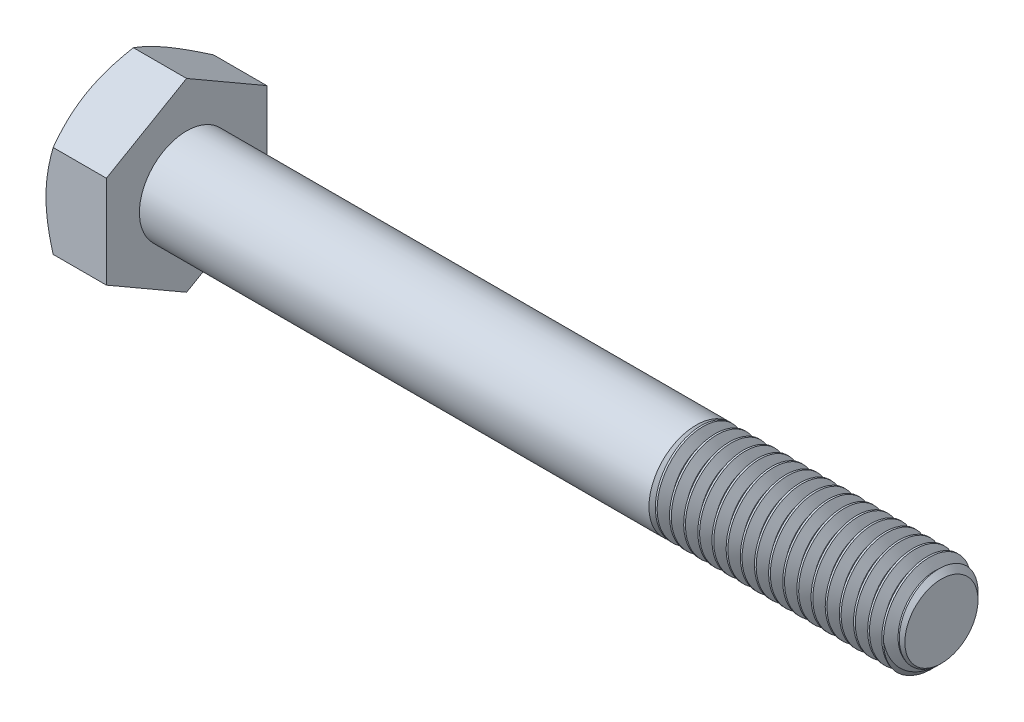
from build123d import *

# Parameters (mm, degrees)
SKETCH2_R           = 5
BOSS_EXTRUDE1_DEPTH = 80
CHAMFER1_SIZE       = 1.125
CUT_SWEEP1_PITCH    = 1.5
BOSS_EXTRUDE2_DEPTH = 6.4
SKETCH6_OUTSIDE_W   = 343.166
SKETCH6_OUTSIDE_H   = 345.796
SKETCH6_OUTSIDE_R   = 8.5
CUT_EXTRUDE1_DEPTH  = 88.370151392
CUT_EXTRUDE1_DRAFT  = -60
SKETCH7_W           = 0.395125951
SKETCH7_H           = 0.395125952
CUT_EXTRUDE2_DEPTH  = 0.25


with BuildPart() as part:
    # Sketch2 → Boss-Extrude1 (new body)
    with BuildSketch(Plane(origin=(43.2, 0, 0), x_dir=(0, 0, -1), z_dir=(1, 0, 0))):
        Circle(SKETCH2_R)
    extrude(amount=-BOSS_EXTRUDE1_DEPTH)

    # Chamfer1
    chamfer1_edges = [part.edges().sort_by_distance(p)[0] for p in [
        (43.2, 0, 5),
    ]]
    chamfer(chamfer1_edges, length=CHAMFER1_SIZE)

    # Cut-Sweep1: the profile of Sketch5 profile screwed along a right-hand helix of 54.333333 turns, 6 arcs to a turn; built about Z, then put on its axis
    cut_sweep1_z = Axis((0, 0, 0), (0, 0, 1))
    cut_sweep1_corners = [(5.0003, 0, 0.000173205), (4.025721421, 0, -0.5625), (4.025721421, 0, -0.75), (5.0003, 0, -1.312673205)]
    with BuildLine(mode=Mode.PRIVATE) as cut_sweep1_profile:
        Line(cut_sweep1_corners[0], cut_sweep1_corners[1])
        Line(cut_sweep1_corners[1], cut_sweep1_corners[2])
        Line(cut_sweep1_corners[2], cut_sweep1_corners[3])
        Line(cut_sweep1_corners[3], cut_sweep1_corners[0])
    cut_sweep1_cap = Face(cut_sweep1_profile.wire())
    cut_sweep1_turn_angles = [0, 30, 60, 90, 120, 150, 180, 210, 240, 270, 300, 330, 360, 390, 420, 450, 480, 510, 540, 570, 600, 630, 660, 690, 720]
    cut_sweep1_turn_weights = [1, 0.8660254037844387, 1, 0.8660254037844387, 1, 0.8660254037844387, 1, 0.8660254037844387, 1, 0.8660254037844387, 1, 0.8660254037844387, 1, 0.8660254037844387, 1, 0.8660254037844387, 1, 0.8660254037844387, 1, 0.8660254037844387, 1, 0.8660254037844387, 1, 0.8660254037844387, 1]
    cut_sweep1_turn_rails = [Edge.make_bspline([Vector(p[0], p[1], 0).rotate(cut_sweep1_z, cut_sweep1_turn_angles[k]) / cut_sweep1_turn_weights[k] + Vector(0, 0, p[2] + CUT_SWEEP1_PITCH * cut_sweep1_turn_angles[k] / 360) for k in range(25)], [0, 0, 0, 1, 1, 2, 2, 3, 3, 4, 4, 5, 5, 6, 6, 7, 7, 8, 8, 9, 9, 10, 10, 11, 11, 12, 12, 12], 2, cut_sweep1_turn_weights) for p in cut_sweep1_corners]
    cut_sweep1_turn_sides = [Face.make_surface_from_curves(cut_sweep1_turn_rails[p[0]], cut_sweep1_turn_rails[p[1]]) for p in [(0, 1), (1, 2), (2, 3), (3, 0)]]
    cut_sweep1_last_angles = [19440, 19470, 19500, 19530, 19560]
    cut_sweep1_last_weights = [1, 0.8660254037844387, 1, 0.8660254037846767, 1]
    cut_sweep1_last_rails = [Edge.make_bspline([Vector(p[0], p[1], 0).rotate(cut_sweep1_z, cut_sweep1_last_angles[k]) / cut_sweep1_last_weights[k] + Vector(0, 0, p[2] + CUT_SWEEP1_PITCH * cut_sweep1_last_angles[k] / 360) for k in range(5)], [0, 0, 0, 1, 1, 2, 2, 2], 2, cut_sweep1_last_weights) for p in cut_sweep1_corners]
    cut_sweep1_last_sides = [Face.make_surface_from_curves(cut_sweep1_last_rails[p[0]], cut_sweep1_last_rails[p[1]]) for p in [(0, 1), (1, 2), (2, 3), (3, 0)]]
    cut_sweep1 = Plane(origin=(43.2, 0, 0), x_dir=(0, 1, 0), z_dir=(-1, 0, 0)) * Solid(Shell([*[p.moved(Location((0, 0, 2 * CUT_SWEEP1_PITCH * i))) for i in range(27) for p in cut_sweep1_turn_sides], *cut_sweep1_last_sides, cut_sweep1_cap, cut_sweep1_cap.rotate(cut_sweep1_z, 19560).moved(Location((0, 0, CUT_SWEEP1_PITCH * 19560 / 360)))]))
    add(cut_sweep1, mode=Mode.SUBTRACT)

    # Sketch3 → Boss-Extrude2 (add)
    with BuildSketch(Plane.ZY.offset(36.8)):
        Polygon((-8.5, -4.907477288), (0, -9.814954576), (8.5, -4.907477288), (8.5, 4.907477288), (0, 9.814954576), (-8.5, 4.907477288), align=None)
    extrude(amount=BOSS_EXTRUDE2_DEPTH)


with BuildPart() as cut_extrude1_tool:
    # Sketch6 outside → Cut-Extrude1 (with draft: the straight prism first)
    with BuildSketch(Plane.ZY.offset(43.2)):
        Rectangle(SKETCH6_OUTSIDE_W, SKETCH6_OUTSIDE_H)
        Circle(SKETCH6_OUTSIDE_R, mode=Mode.SUBTRACT)
    extrude(amount=-CUT_EXTRUDE1_DEPTH)
    # Cut-Extrude1: the draft: its side faces are tilted about the plane it starts from
    cut_extrude1_sides = [cut_extrude1_tool.faces().sort_by_distance(p)[0] for p in [
        (0.985075696, -172.898, 0),
        (0.985075696, 0, 171.583),
        (0.985075696, 172.898, 0),
        (0.985075696, 0, -171.583),
        (0.985075696, 0, -8.5),
    ]]
    draft(cut_extrude1_sides, Plane.ZY.offset(43.2), CUT_EXTRUDE1_DRAFT)


with BuildPart() as part_1:
    add(part.part)

    # Cut-Extrude1: cut by cut_extrude1_tool
    add(cut_extrude1_tool.part, mode=Mode.SUBTRACT)

    # Sketch7 → Cut-Extrude2 (cut)
    # profile 1 of 4: a face of its own
    with BuildSketch(Plane.ZY.offset(43.2)):
        with BuildLine():
            Line((-2.568318685, 4.25), (-2.963444636, 4.25))
            Line((-2.963444636, 4.25), (-2.963444636, 6.651624924))
            add(Edge.make_bspline(
                [(-2.963444636, 6.651624924), (-2.986196024, 6.62968401), (-3.033482289, 6.584082225), (-3.113414724, 6.519544312), (-3.202629538, 6.454132402), (-3.299968218, 6.391231537), (-3.399188536, 6.332017157), (-3.495072199, 6.278762925), (-3.586018389, 6.233696924), (-3.645925135, 6.209054656), (-3.674671349, 6.19723008)],
                knots=[0, 0, 0, 0, 0.893362401, 1.856755847, 2.901947673, 4.020460078, 5.132200827, 6.168787962, 7.121294059, 8, 8, 8, 8], degree=3))
            Line((-3.674671349, 6.19723008), (-3.674671349, 6.561486816))
            add(Edge.make_bspline(
                [(-3.674671349, 6.561486816), (-3.625296755, 6.586914831), (-3.527982354, 6.637031942), (-3.390498149, 6.723591083), (-3.262141854, 6.817424755), (-3.145038274, 6.918512183), (-3.040062377, 7.021841681), (-2.951597664, 7.126105204), (-2.877576021, 7.2274809), (-2.840437961, 7.298179205), (-2.822681016, 7.331982422)],
                knots=[0, 0, 0, 0, 1.141258006, 2.249351951, 3.335817539, 4.406819942, 5.426913362, 6.360259544, 7.215985427, 8, 8, 8, 8], degree=3))
            Line((-2.822681016, 7.331982422), (-2.568318685, 7.331982422))
            Line((-2.568318685, 7.331982422), (-2.568318685, 4.25))
        make_face()
    # profile 2 of 4: a face of its own
    with BuildSketch(Plane.ZY.offset(43.2)):
        with BuildLine():
            add(Edge.make_bspline(
                [(-1.580503806, 5.770000145), (-1.580105717, 5.814044503), (-1.579326027, 5.900308852), (-1.574489865, 6.026529092), (-1.566046319, 6.146395227), (-1.553442429, 6.25980316), (-1.538517061, 6.367008875), (-1.519113989, 6.467859377), (-1.497282713, 6.562580942), (-1.471089099, 6.651074836), (-1.442310892, 6.734101948), (-1.409661098, 6.811529082), (-1.372925651, 6.883274147), (-1.333909869, 6.950081181), (-1.290559882, 7.010911058), (-1.245492208, 7.067470914), (-1.195431598, 7.117686479), (-1.142459679, 7.162849803), (-1.085796427, 7.202703805), (-1.025741645, 7.237093001), (-0.962526408, 7.267456182), (-0.894945905, 7.290313577), (-0.824403092, 7.308947199), (-0.750354969, 7.322654317), (-0.672719934, 7.330735126), (-0.619667301, 7.33156196), (-0.592688927, 7.331982422)],
                knots=[0, 0, 0, 0, 1.514747001, 2.966751498, 4.343369068, 5.64627492, 6.890416844, 8.064737671, 9.177176366, 10.232018008, 11.237056675, 12.19799043, 13.119080079, 14.007588942, 14.855863561, 15.685992447, 16.491747269, 17.290132607, 18.077525251, 18.870243746, 19.668095604, 20.485086593, 21.319398728, 22.175900658, 23.072407314, 24, 24, 24, 24], degree=3))
            add(Edge.make_bspline(
                [(-0.592688927, 7.331982422), (-0.553108144, 7.330818775), (-0.475350106, 7.328532744), (-0.361822971, 7.309888287), (-0.254830962, 7.277994072), (-0.154443593, 7.234967399), (-0.06237697, 7.180315243), (0.019842406, 7.113877221), (0.091327664, 7.036350919), (0.151298654, 6.946817676), (0.203719286, 6.847747416), (0.250288624, 6.738695476), (0.292385953, 6.61978406), (0.322259135, 6.513341743), (0.34356765, 6.421456958), (0.357672195, 6.345672987), (0.369381794, 6.263901655), (0.37835293, 6.17634079), (0.385713535, 6.083088599), (0.391397793, 5.98408702), (0.394283136, 5.879088618), (0.394839746, 5.807044656), (0.395125952, 5.770000145)],
                knots=[0, 0, 0, 0, 1.134486744, 2.228744715, 3.287356444, 4.328707449, 5.352829806, 6.347195599, 7.349461267, 8.364207941, 9.428085653, 10.559314403, 11.761222316, 13.04268526, 13.726896727, 14.465273606, 15.252205015, 16.094778733, 16.988606776, 17.934225168, 18.937792761, 20, 20, 20, 20], degree=3))
            add(Edge.make_bspline(
                [(0.395125952, 5.770000145), (0.394720405, 5.72616267), (0.393928091, 5.640517533), (0.389221516, 5.515309367), (0.380269187, 5.396347563), (0.369253182, 5.283359615), (0.352588275, 5.176647146), (0.334630934, 5.075756765), (0.312422139, 4.981146602), (0.286509689, 4.892775193), (0.257326387, 4.81017526), (0.22532238, 4.73272256), (0.189874869, 4.660470016), (0.149928803, 4.594122345), (0.107311894, 4.532798891), (0.061712021, 4.476269617), (0.01216241, 4.425348143), (-0.041286868, 4.380320284), (-0.097552273, 4.339759529), (-0.157753059, 4.305030807), (-0.221625737, 4.276258665), (-0.288743547, 4.251659912), (-0.359787497, 4.233635389), (-0.434197342, 4.219837898), (-0.512247246, 4.211712937), (-0.565505082, 4.210901552), (-0.592688927, 4.210487405)],
                knots=[0, 0, 0, 0, 1.508974709, 2.94807912, 4.311757619, 5.615040294, 6.854280449, 8.028314546, 9.141715822, 10.197470207, 11.196696834, 12.155719058, 13.080757287, 13.963948316, 14.818758719, 15.649605906, 16.461113142, 17.260189315, 18.052359509, 18.845763934, 19.647754795, 20.461145776, 21.303032214, 22.167241874, 23.064524267, 24, 24, 24, 24], degree=3))
            add(Edge.make_bspline(
                [(-0.592688927, 4.210487405), (-0.6283301, 4.211504071), (-0.697820578, 4.213486291), (-0.799306296, 4.226954252), (-0.894556056, 4.250658495), (-0.984373234, 4.282449228), (-1.067748262, 4.324971164), (-1.145079221, 4.376707402), (-1.217920022, 4.436454245), (-1.259851615, 4.483593132), (-1.281072421, 4.507449253)],
                knots=[0, 0, 0, 0, 1.10322584, 2.150986741, 3.161425019, 4.136713905, 5.093944212, 6.049774532, 7.013026876, 8, 8, 8, 8], degree=3))
            add(Edge.make_bspline(
                [(-1.281072421, 4.507449253), (-1.305498056, 4.54268359), (-1.355864762, 4.615338302), (-1.414814624, 4.739221326), (-1.467398945, 4.875599141), (-1.508667995, 5.027147464), (-1.540991949, 5.192660143), (-1.564337915, 5.372461948), (-1.577549433, 5.566475199), (-1.579496784, 5.700627011), (-1.580503806, 5.770000145)],
                knots=[0, 0, 0, 0, 0.779365345, 1.607084704, 2.489375761, 3.438383567, 4.461919411, 5.557722155, 6.737039282, 8, 8, 8, 8], degree=3))
        make_face()
        with BuildLine():
            add(Edge.make_bspline(
                [(-1.185377855, 5.771234913), (-1.184985526, 5.711957182), (-1.184234522, 5.598486491), (-1.176388355, 5.436374033), (-1.162881502, 5.290126467), (-1.145024559, 5.159946283), (-1.121446166, 5.045657386), (-1.091840703, 4.94755102), (-1.058468306, 4.864449686), (-1.017170596, 4.79738336), (-0.971954166, 4.742714521), (-0.925271291, 4.695697552), (-0.876023686, 4.655734205), (-0.824532686, 4.622412923), (-0.769999369, 4.597184238), (-0.71302005, 4.57889843), (-0.653582329, 4.568375229), (-0.61310254, 4.566863243), (-0.592688927, 4.566100761)],
                knots=[0, 0, 0, 0, 1.89448813, 3.626469325, 5.185477471, 6.587276848, 7.82441448, 8.910550357, 9.859733512, 10.6775885, 11.416198291, 12.123144072, 12.791880183, 13.439617036, 14.078171869, 14.70637855, 15.347637704, 16, 16, 16, 16], degree=3))
            add(Edge.make_bspline(
                [(-0.592688927, 4.566100761), (-0.572280426, 4.566879903), (-0.531810774, 4.568424926), (-0.472235717, 4.578716081), (-0.415478091, 4.597943229), (-0.361026084, 4.623082807), (-0.309160831, 4.655644596), (-0.260155096, 4.695758894), (-0.213226305, 4.742747946), (-0.168212986, 4.798052211), (-0.127229907, 4.865428606), (-0.093231484, 4.948462246), (-0.064087407, 5.046740426), (-0.040379634, 5.160971093), (-0.022449029, 5.290945453), (-0.009023839, 5.436787394), (-0.001125164, 5.598691266), (-0.000386554, 5.711956914), (0, 5.771234913)],
                knots=[0, 0, 0, 0, 0.652509534, 1.29391342, 1.924290653, 2.562989607, 3.207355802, 3.876242846, 4.583348185, 5.32723334, 6.150888545, 7.094226006, 8.186903555, 9.424320409, 10.81992305, 12.379283064, 14.105084285, 16, 16, 16, 16], degree=3))
            add(Edge.make_bspline(
                [(0, 5.771234913), (-0.000374177, 5.829279529), (-0.001091087, 5.940490817), (-0.00919348, 6.099480175), (-0.021890658, 6.243273035), (-0.03925838, 6.372001961), (-0.06234008, 6.4855272), (-0.090335034, 6.584090432), (-0.123695207, 6.667481456), (-0.163360333, 6.736537934), (-0.207515555, 6.79318298), (-0.253639871, 6.842214197), (-0.302886392, 6.883913649), (-0.356127619, 6.917365565), (-0.411647487, 6.944353326), (-0.470721702, 6.962926991), (-0.53276961, 6.974338069), (-0.575352285, 6.975684332), (-0.597010617, 6.976369066)],
                knots=[0, 0, 0, 0, 1.850066095, 3.544656626, 5.0727657, 6.45041401, 7.682899467, 8.762389858, 9.712573485, 10.538438529, 11.291566246, 11.996865408, 12.681389046, 13.341983376, 13.996294293, 14.643563182, 15.31009126, 16, 16, 16, 16], degree=3))
            add(Edge.make_bspline(
                [(-0.597010617, 6.976369066), (-0.617422948, 6.975833322), (-0.65767345, 6.974776906), (-0.716605455, 6.964693418), (-0.772454624, 6.94783158), (-0.825860807, 6.924990582), (-0.875490749, 6.894251111), (-0.923312648, 6.858360591), (-0.967086713, 6.814631997), (-0.99346458, 6.781941185), (-1.006953792, 6.765223635)],
                knots=[0, 0, 0, 0, 1.021318143, 2.013908504, 2.982026795, 3.937174072, 4.91255697, 5.897578595, 6.924855925, 8, 8, 8, 8], degree=3))
            add(Edge.make_bspline(
                [(-1.006953792, 6.765223635), (-1.021639429, 6.740670733), (-1.052652401, 6.688820173), (-1.087354113, 6.598701764), (-1.118008235, 6.495713576), (-1.14324674, 6.378271061), (-1.161505027, 6.24657568), (-1.175919239, 6.100780372), (-1.183406886, 5.94068159), (-1.184702739, 5.829275502), (-1.185377855, 5.771234913)],
                knots=[0, 0, 0, 0, 0.671104906, 1.417232262, 2.260109084, 3.195198885, 4.23592645, 5.382417421, 6.636286093, 8, 8, 8, 8], degree=3))
        make_face(mode=Mode.SUBTRACT)
    # profile 3 of 4: a face of its own
    with BuildSketch(Plane.ZY.offset(43.2)):
        with Locations((1.185377854, 4.447562976)):
            Rectangle(SKETCH7_W, SKETCH7_H)
    # profile 4 of 4: a face of its own
    with BuildSketch(Plane.ZY.offset(43.2)):
        with BuildLine():
            Line((2.015142353, 5.000739308), (2.410268304, 5.040251903))
            add(Edge.make_bspline(
                [(2.410268304, 5.040251903), (2.413840479, 5.020007204), (2.420745795, 4.980872485), (2.436328917, 4.925098804), (2.452134025, 4.873095247), (2.47253629, 4.826020329), (2.493783762, 4.782595367), (2.517845941, 4.74325551), (2.545151535, 4.708790889), (2.583710618, 4.668404495), (2.638420343, 4.626260608), (2.714255437, 4.592122416), (2.797681164, 4.569168901), (2.856473329, 4.567146852), (2.886888983, 4.566100761)],
                knots=[0, 0, 0, 0, 0.994516507, 1.922484754, 2.80151264, 3.623050913, 4.402748861, 5.140924173, 5.850441436, 6.526872911, 7.841975818, 9.161260782, 10.53140107, 12, 12, 12, 12], degree=3))
            add(Edge.make_bspline(
                [(2.886888983, 4.566100761), (2.913502977, 4.567059155), (2.965883441, 4.568945423), (3.042255893, 4.583567924), (3.114884907, 4.606992865), (3.182506216, 4.640602748), (3.244873712, 4.681505039), (3.299349616, 4.7301052), (3.346661352, 4.784310082), (3.385518984, 4.846764506), (3.418685022, 4.918097941), (3.450022517, 4.9992176), (3.479667267, 5.091521035), (3.506013778, 5.193830946), (3.529605789, 5.302412185), (3.546162435, 5.414804415), (3.556349093, 5.528822559), (3.557438834, 5.605548926), (3.557985717, 5.644053748)],
                knots=[0, 0, 0, 0, 0.897794352, 1.766998465, 2.614902619, 3.466100941, 4.308008728, 5.124841802, 5.922729683, 6.728261092, 7.598214292, 8.574707161, 9.662086263, 10.868425066, 12.139522319, 13.41071447, 14.70057738, 16, 16, 16, 16], degree=3))
            add(Edge.make_bspline(
                [(3.557985717, 5.644053748), (3.557798688, 5.654549729), (3.557351233, 5.67966075), (3.556581539, 5.704764073), (3.556133564, 5.719374632)],
                knots=[0, 0, 0, 0, 0.835966126, 2, 2, 2, 2], degree=3))
            add(Edge.make_bspline(
                [(3.556133564, 5.719374632), (3.537085168, 5.69044826), (3.499019071, 5.632642126), (3.428891918, 5.555059298), (3.348665223, 5.486242275), (3.259556771, 5.426725431), (3.16376686, 5.377881138), (3.062961935, 5.342388897), (2.95801097, 5.320472904), (2.886583026, 5.318060151), (2.85046331, 5.316840069)],
                knots=[0, 0, 0, 0, 0.978840568, 1.956103883, 2.947027447, 3.962820877, 4.980997961, 5.980964245, 6.979013046, 8, 8, 8, 8], degree=3))
            add(Edge.make_bspline(
                [(2.85046331, 5.316840069), (2.820363425, 5.317619924), (2.761111224, 5.319155084), (2.674317174, 5.332799095), (2.59083831, 5.353260274), (2.511465687, 5.38423949), (2.43496438, 5.42255281), (2.362137653, 5.469579471), (2.292873286, 5.525255467), (2.228066286, 5.588887534), (2.168924197, 5.659813801), (2.1167677, 5.736306369), (2.073457016, 5.818739261), (2.037421028, 5.906083595), (2.009615469, 5.999183298), (1.990294246, 6.097820225), (1.977299795, 6.201617852), (1.976193821, 6.272715691), (1.975629758, 6.308976638)],
                knots=[0, 0, 0, 0, 0.975490236, 1.920271282, 2.842894855, 3.757591483, 4.67685385, 5.613562631, 6.563069669, 7.554119451, 8.55387214, 9.553424333, 10.550567425, 11.568071726, 12.613215376, 13.695622473, 14.824733476, 16, 16, 16, 16], degree=3))
            add(Edge.make_bspline(
                [(1.975629758, 6.308976638), (1.976474577, 6.346465906), (1.978127192, 6.419801416), (1.990610702, 6.527027039), (2.011263538, 6.628609974), (2.041382852, 6.724356326), (2.078630372, 6.81488129), (2.12559805, 6.899532199), (2.180477352, 6.978671167), (2.24359618, 7.051535224), (2.312963199, 7.116914452), (2.386610891, 7.175266551), (2.465498944, 7.223231698), (2.548114747, 7.263222666), (2.635083515, 7.294128288), (2.726256605, 7.316466558), (2.82188631, 7.329573957), (2.887054298, 7.331169976), (2.920227735, 7.331982422)],
                knots=[0, 0, 0, 0, 1.151671969, 2.252870106, 3.311924673, 4.331900944, 5.332425074, 6.314476151, 7.300265758, 8.286521684, 9.270545387, 10.225535917, 11.167946231, 12.101233205, 13.04124339, 13.998220545, 14.981004193, 16, 16, 16, 16], degree=3))
            add(Edge.make_bspline(
                [(2.920227735, 7.331982422), (2.94432121, 7.331495139), (2.99221098, 7.330526585), (3.063480901, 7.323131988), (3.133063159, 7.309802016), (3.201411424, 7.292975846), (3.267372851, 7.269619853), (3.332218948, 7.242611039), (3.395167577, 7.209577215), (3.456585533, 7.172013619), (3.516087062, 7.130580547), (3.5708319, 7.08297843), (3.623008165, 7.032461421), (3.671554138, 6.977444063), (3.714934318, 6.917077255), (3.756093766, 6.853495263), (3.793048395, 6.785310706), (3.82674845, 6.712431238), (3.856742807, 6.633356658), (3.881765615, 6.546339503), (3.903215744, 6.451078381), (3.921075091, 6.347447023), (3.934318089, 6.235519309), (3.944064162, 6.115461586), (3.950444498, 5.987182534), (3.950982503, 5.898835628), (3.951259515, 5.853347025)],
                knots=[0, 0, 0, 0, 0.850689348, 1.69088598, 2.526071361, 3.350886897, 4.173587108, 4.994166539, 5.82944675, 6.680632524, 7.535501428, 8.385942454, 9.238956306, 10.098905971, 10.972410977, 11.861345628, 12.77184846, 13.708225841, 14.694799433, 15.754852217, 16.902446579, 18.141290626, 19.466225842, 20.880733292, 22.39393263, 24, 24, 24, 24], degree=3))
            add(Edge.make_bspline(
                [(3.951259515, 5.853347025), (3.95098065, 5.805800798), (3.950437151, 5.713135114), (3.944006726, 5.577866732), (3.934265553, 5.449997731), (3.921013197, 5.329444138), (3.903029348, 5.216389944), (3.881654113, 5.110854913), (3.856445668, 5.01264421), (3.826822072, 4.921749212), (3.793145767, 4.837125352), (3.756246485, 4.757730608), (3.714921334, 4.683682393), (3.669634643, 4.614838699), (3.62096792, 4.551079194), (3.568161315, 4.492574683), (3.511197678, 4.439502014), (3.450803114, 4.391263907), (3.38706826, 4.348754021), (3.320860767, 4.311244334), (3.251433446, 4.280517335), (3.179500028, 4.255310009), (3.105188338, 4.234497271), (3.027893097, 4.22047361), (2.947971408, 4.212531088), (2.893903336, 4.211174554), (2.866515301, 4.210487405)],
                knots=[0, 0, 0, 0, 1.538356107, 2.998194159, 4.380716326, 5.687456969, 6.921258146, 8.08355215, 9.170518603, 10.200253214, 11.174652363, 12.115998813, 13.031191965, 13.915860606, 14.780247615, 15.624154577, 16.462764255, 17.29681422, 18.1223677, 18.939254916, 19.756006416, 20.575278551, 21.404021733, 22.250368457, 23.113728878, 24, 24, 24, 24], degree=3))
            add(Edge.make_bspline(
                [(2.866515301, 4.210487405), (2.837465496, 4.210989678), (2.780629433, 4.211972379), (2.697654628, 4.222305542), (2.618610112, 4.238015318), (2.54372593, 4.261206667), (2.472441271, 4.289754596), (2.405972827, 4.326237225), (2.343139367, 4.368327264), (2.284716063, 4.416873494), (2.231386971, 4.471697642), (2.183134335, 4.531448544), (2.14083099, 4.596900077), (2.104698323, 4.667666359), (2.072693162, 4.743152029), (2.047880459, 4.824369304), (2.027722524, 4.910569119), (2.019403459, 4.970197213), (2.015142353, 5.000739308)],
                knots=[0, 0, 0, 0, 1.08199657, 2.11693069, 3.111083497, 4.081436044, 5.034173265, 5.967546613, 6.901297947, 7.84883568, 8.792454994, 9.747011506, 10.706361727, 11.690764787, 12.70483191, 13.757514363, 14.851376857, 16, 16, 16, 16], degree=3))
        make_face()
        with BuildLine():
            add(Edge.make_bspline(
                [(3.556133564, 6.317620018), (3.555689168, 6.342334996), (3.554824182, 6.390441115), (3.547245845, 6.460627345), (3.535052351, 6.526721926), (3.517937883, 6.58910491), (3.494695926, 6.647115014), (3.467771704, 6.70210662), (3.434846089, 6.752555524), (3.397695315, 6.799141057), (3.356772987, 6.840810741), (3.312208949, 6.877142978), (3.264838742, 6.908287943), (3.21352595, 6.932776261), (3.159957389, 6.952954547), (3.102846268, 6.96614229), (3.04297843, 6.975380567), (3.001760115, 6.976035124), (2.980731397, 6.976369066)],
                knots=[0, 0, 0, 0, 1.20361398, 2.342757417, 3.433960756, 4.474970456, 5.487648377, 6.473933575, 7.452701285, 8.415527761, 9.372491588, 10.291530068, 11.211879743, 12.12647906, 13.055739058, 13.994253148, 14.97671008, 16, 16, 16, 16], degree=3))
            add(Edge.make_bspline(
                [(2.980731397, 6.976369066), (2.959101426, 6.975713619), (2.916490327, 6.974422386), (2.854035287, 6.966106794), (2.794804377, 6.950184996), (2.73839772, 6.929065091), (2.684188839, 6.902940141), (2.634148442, 6.868708472), (2.586180661, 6.829915507), (2.54220941, 6.784910501), (2.502043122, 6.735567373), (2.466652196, 6.682349267), (2.436848552, 6.625230105), (2.413024256, 6.564448035), (2.3935543, 6.500532839), (2.380179825, 6.432913013), (2.371950319, 6.361660546), (2.371159847, 6.312909916), (2.370755709, 6.287985572)],
                knots=[0, 0, 0, 0, 1.007165334, 1.984118292, 2.925321257, 3.856078893, 4.785899085, 5.718627206, 6.671847665, 7.654235469, 8.641842333, 9.630378272, 10.624608936, 11.635186472, 12.665777387, 13.731187195, 14.840042241, 16, 16, 16, 16], degree=3))
            add(Edge.make_bspline(
                [(2.370755709, 6.287985572), (2.371128962, 6.265727279), (2.371860764, 6.22208742), (2.380575729, 6.158399021), (2.392200198, 6.097614263), (2.410731799, 6.040353602), (2.433056995, 5.985785726), (2.462072883, 5.935163867), (2.49474201, 5.886974334), (2.533020218, 5.84283148), (2.575336858, 5.802786174), (2.62155522, 5.767882378), (2.671091516, 5.738004124), (2.724405959, 5.713956363), (2.781178829, 5.695436051), (2.841283402, 5.681801365), (2.904980937, 5.673680208), (2.948603683, 5.672867793), (2.970853248, 5.672453425)],
                knots=[0, 0, 0, 0, 1.102204012, 2.160993585, 3.181057555, 4.164839289, 5.138418409, 6.097303793, 7.050641095, 8.019669129, 8.986440483, 9.932879371, 10.884360123, 11.847412593, 12.824617322, 13.839006415, 14.897795988, 16, 16, 16, 16], degree=3))
            add(Edge.make_bspline(
                [(2.970853248, 5.672453425), (2.991663789, 5.672871843), (3.032623591, 5.673695382), (3.092625396, 5.681851159), (3.149638391, 5.695511131), (3.203918555, 5.714082438), (3.255377912, 5.738121883), (3.303670426, 5.768237575), (3.349729628, 5.802742512), (3.392205347, 5.843059847), (3.431026598, 5.887699021), (3.464599762, 5.93710103), (3.493269443, 5.990368719), (3.515835399, 6.048133488), (3.533909661, 6.10968415), (3.546635142, 6.175410391), (3.554968835, 6.245171906), (3.555739449, 6.293105409), (3.556133564, 6.317620018)],
                knots=[0, 0, 0, 0, 1.017004716, 2.00169281, 2.953445817, 3.879374072, 4.80207141, 5.723561102, 6.657273834, 7.611045633, 8.581233951, 9.544037932, 10.525327521, 11.53237926, 12.57032081, 13.657564536, 14.802009319, 16, 16, 16, 16], degree=3))
        make_face(mode=Mode.SUBTRACT)
    extrude(amount=-CUT_EXTRUDE2_DEPTH, mode=Mode.SUBTRACT)

    # Sketch9 → Revolve1 (revolve)
    with BuildSketch(Plane.XY, mode=Mode.PRIVATE) as revolve1_sk:
        Polygon((-36.8, 5), (-36.8, 0), (22.2, 0), (17.2, 5), align=None)
    revolve(revolve1_sk.sketch.rotate(Axis((-36.8, 0, 0), (1, 0, 0)), 270), axis=Axis((-36.8, 0, 0), (1, 0, 0)))


solid = part_1.part
